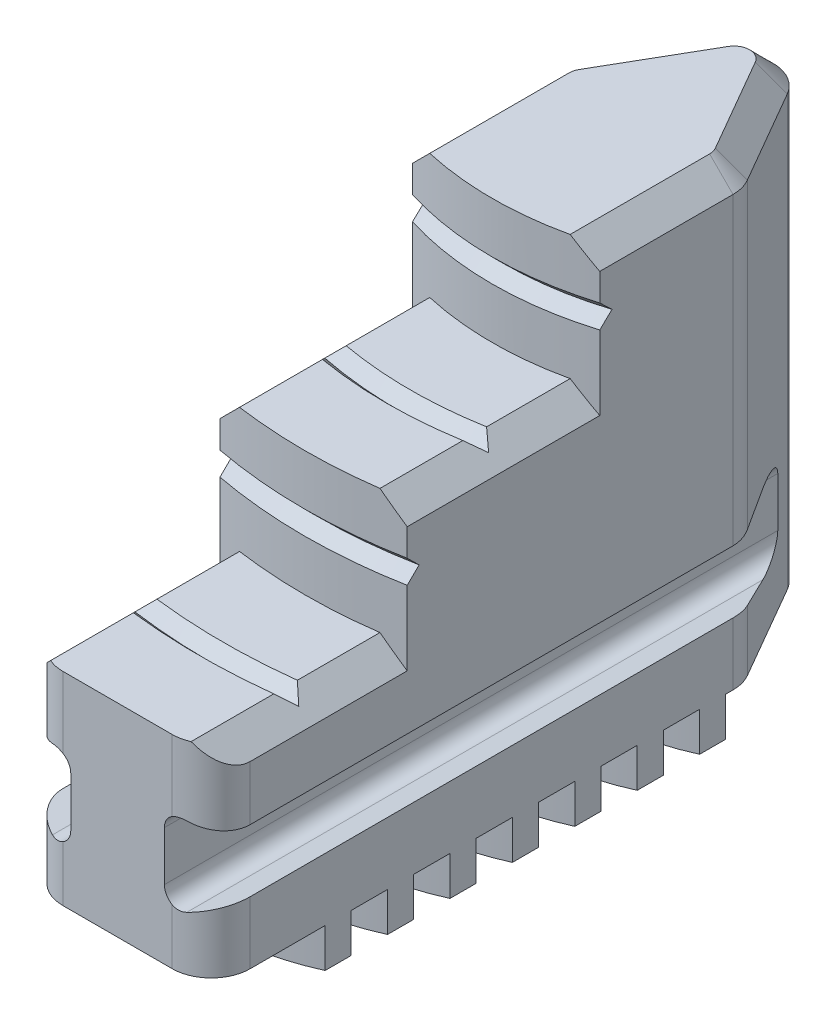
from build123d import *

# Parameters (mm, degrees)
BOSS_EXTRUDE1_DEPTH = 58
BOSS_EXTRUDE2_DEPTH = 5
CUT_EXTRUDE1_DEPTH  = 103.78132126
CHAMFER1_SIZE       = 3


with BuildPart() as part:
    # Sketch1 → Boss-Extrude1 (new body)
    with BuildSketch(Plane(origin=(0, 0, 0), x_dir=(1, 0, 0), z_dir=(0, 1, 0))):
        with BuildLine():
            Line((-7, 0), (7, 0))
            ThreePointArc((7, 0), (10.535533906, 1.464466094), (12, 5))
            Line((12, 5), (12, 66.875644347))
            ThreePointArc((12, 66.875644347), (11.829629131, 68.169739573), (11.330127019, 69.375644347))
            Line((11.330127019, 69.375644347), (4.330127019, 81.5))
            ThreePointArc((4.330127019, 81.5), (0, 84), (-4.330127019, 81.5))
            Line((-4.330127019, 81.5), (-11.330127019, 69.375644347))
            ThreePointArc((-11.330127019, 69.375644347), (-11.829629131, 68.169739573), (-12, 66.875644347))
            Line((-12, 66.875644347), (-12, 5))
            ThreePointArc((-12, 5), (-10.535533906, 1.464466094), (-7, 0))
        make_face()
    extrude(amount=BOSS_EXTRUDE1_DEPTH)

    # Sketch2 → Cut-Revolve3 (revolve, cut)
    with BuildSketch(Plane(origin=(0, 0, 0), x_dir=(0, 0, -1), z_dir=(1, 0, 0))):
        Polygon((48, 61), (48, 58), (48, 51.5), (49.5, 50), (48, 48.5), (48, 42), (37.5, 42), (36, 40.5), (34.5, 42), (24, 42), (24, 35.5), (25.5, 34), (24, 32.5), (24, 26), (13.5, 26), (12, 24.5), (10.5, 26), (0, 26), (-2, 26), (-2, 61), align=None)
    revolve(axis=Axis((0, 58, -89), (0, -1, 0)), mode=Mode.SUBTRACT)

    # Sketch3 → Boss-Extrude2 (add)
    with BuildSketch(Plane.XZ):
        with BuildLine():
            Line((-12, -54.599242435), (-12, -57.934874811))
            ThreePointArc((-12, -57.934874811), (0, -55), (12, -57.934874811))
            Line((12, -57.934874811), (12, -54.599242435))
            ThreePointArc((12, -54.599242435), (0, -52), (-12, -54.599242435))
        make_face()
        with BuildLine():
            Line((-12, -62.599242435), (-12, -65.934874811))
            ThreePointArc((-12, -65.934874811), (0, -63), (12, -65.934874811))
            Line((12, -65.934874811), (12, -62.599242435))
            ThreePointArc((12, -62.599242435), (0, -60), (-12, -62.599242435))
        make_face()
        with BuildLine():
            Line((-12, -46.599242435), (-12, -49.934874811))
            ThreePointArc((-12, -49.934874811), (0, -47), (12, -49.934874811))
            Line((12, -49.934874811), (12, -46.599242435))
            ThreePointArc((12, -46.599242435), (0, -44), (-12, -46.599242435))
        make_face()
        with BuildLine():
            Line((-12, -38.599242435), (-12, -41.934874811))
            ThreePointArc((-12, -41.934874811), (0, -39), (12, -41.934874811))
            Line((12, -41.934874811), (12, -38.599242435))
            ThreePointArc((12, -38.599242435), (0, -36), (-12, -38.599242435))
        make_face()
        with BuildLine():
            Line((-12, -30.599242435), (-12, -33.934874811))
            ThreePointArc((-12, -33.934874811), (0, -31), (12, -33.934874811))
            Line((12, -33.934874811), (12, -30.599242435))
            ThreePointArc((12, -30.599242435), (0, -28), (-12, -30.599242435))
        make_face()
        with BuildLine():
            Line((-12, -22.599242435), (-12, -25.934874811))
            ThreePointArc((-12, -25.934874811), (0, -23), (12, -25.934874811))
            Line((12, -25.934874811), (12, -22.599242435))
            ThreePointArc((12, -22.599242435), (0, -20), (-12, -22.599242435))
        make_face()
        with BuildLine():
            Line((-12, -14.599242435), (-12, -17.934874811))
            ThreePointArc((-12, -17.934874811), (0, -15), (12, -17.934874811))
            Line((12, -17.934874811), (12, -14.599242435))
            ThreePointArc((12, -14.599242435), (0, -12), (-12, -14.599242435))
        make_face()
    extrude(amount=BOSS_EXTRUDE2_DEPTH)

    # Sketch4 → Cut-Extrude1 (cut, through all)
    with BuildSketch(Plane.XY):
        with BuildLine():
            Line((12, 16), (8.601411599, 17.071570807))
            ThreePointArc((8.601411599, 17.071570807), (6.817380703, 16.777026114), (6, 15.164136905))
            Line((6, 15.164136905), (6, 8.835863095))
            ThreePointArc((6, 8.835863095), (6.817380703, 7.222973886), (8.601411599, 6.928429193))
            Line((8.601411599, 6.928429193), (12, 8))
            Line((12, 8), (12, 16))
        make_face()
        with BuildLine():
            Line((-12, 8), (-12, 16))
            Line((-12, 16), (-8.601411599, 17.071570807))
            ThreePointArc((-8.601411599, 17.071570807), (-6.817380703, 16.777026114), (-6, 15.164136905))
            Line((-6, 15.164136905), (-6, 8.835863095))
            ThreePointArc((-6, 8.835863095), (-6.817380703, 7.222973886), (-8.601411599, 6.928429193))
            Line((-8.601411599, 6.928429193), (-12, 8))
        make_face()
    extrude(amount=-CUT_EXTRUDE1_DEPTH, mode=Mode.SUBTRACT)

    # Chamfer1
    # the kernel refuses this chamfer: 3.639332034, 3.399408886, 3, 2.719454555, 2.619340105 mm, written as the material it takes off along each edge
    with BuildSketch(Plane(origin=(7, 58, -66.875644347), x_dir=(1, 0, 0), z_dir=(0, 0, 1))) as chamfer1_piece_1:
        Polygon((5 - CHAMFER1_SIZE, 0), (5, -CHAMFER1_SIZE), (5, 0), align=None)
    revolve(axis=Axis((7, 58, -66.875644347), (0, 1, 0)), revolution_arc=30, mode=Mode.SUBTRACT)
    with BuildSketch(Plane(origin=(11.330127019, 58, -69.375644347), x_dir=(0, -1, 0), z_dir=(-0.5000000000000017, 0, -0.8660254037844377)), Plane(origin=(-4.330127019, 58, -81.5), x_dir=(0, -1, 0), z_dir=(-0.5000000000000012, 0, 0.8660254037844379))) as chamfer1_piece_2:
        Polygon((CHAMFER1_SIZE, 0), (0, CHAMFER1_SIZE), (0, 0), align=None)
    extrude(amount=14, mode=Mode.SUBTRACT)
    with BuildSketch(Plane(origin=(0, 58, -79), x_dir=(0.8660254037844403, 0, -0.49999999999999706), z_dir=(0.49999999999999706, 0, 0.8660254037844403))) as chamfer1_piece_3:
        Polygon((5, -CHAMFER1_SIZE), (5 - CHAMFER1_SIZE, 0), (5, 0), align=None)
    revolve(axis=Axis((0, 58, -79), (0, 1, 0)), revolution_arc=120, mode=Mode.SUBTRACT)
    with BuildSketch(Plane(origin=(-7, 58, -66.875644347), x_dir=(-0.866025403784439, 0, -0.4999999999999992), z_dir=(0.4999999999999992, 0, -0.866025403784439))) as chamfer1_piece_4:
        Polygon((5, -CHAMFER1_SIZE), (5 - CHAMFER1_SIZE, 0), (5, 0), align=None)
    revolve(axis=Axis((-7, 58, -66.875644347), (0, 1, 0)), revolution_arc=30, mode=Mode.SUBTRACT)
    with BuildSketch(Plane(origin=(12, 58, -42.080359468), x_dir=(-1, 0, 0), z_dir=(0, 0, -1)), Plane(origin=(-12, 58, -66.875644347), x_dir=(1, 0, 0), z_dir=(0, 0, 1))) as chamfer1_piece_5:
        Polygon((CHAMFER1_SIZE, 0), (0, -CHAMFER1_SIZE), (0, 0), align=None)
    extrude(amount=24.795284879, mode=Mode.SUBTRACT)
    with BuildSketch(Plane(origin=(-12, 42, -43.55256219), x_dir=(0, -1, 0), z_dir=(0, 0, 1)), Plane(origin=(12, 42, -17.402246021), x_dir=(0, -1, 0), z_dir=(0, 0, -1))) as chamfer1_piece_6:
        Polygon((CHAMFER1_SIZE, 0), (0, CHAMFER1_SIZE), (0, 0), align=None)
    extrude(amount=26.150316168, mode=Mode.SUBTRACT)
    with BuildSketch(Plane(origin=(12, 26, 2.715048964), x_dir=(-1, 0, 0), z_dir=(0, 0, -1)), Plane(origin=(-12, 26, -19.13766824), x_dir=(1, 0, 0), z_dir=(0, 0, 1))) as chamfer1_piece_7:
        Polygon((CHAMFER1_SIZE, 0), (0, -CHAMFER1_SIZE), (0, 0), align=None)
    extrude(amount=21.852717204, mode=Mode.SUBTRACT)
    # the kernel refuses this chamfer: 3.639332034, 3.399408886, 3, 2.719454555, 2.619340105 mm, written as the material it takes off along each edge
    with BuildSketch(Plane(origin=(-12, 42, -57.510457396), x_dir=(0, -1, 0), z_dir=(0, 0, 1))) as chamfer1_2_piece_1_section:
        Polygon((CHAMFER1_SIZE, 0), (0, CHAMFER1_SIZE), (0, 0), align=None)
    chamfer1_2_piece_1 = extrude(amount=21.67294417, mode=Mode.PRIVATE)
    chamfer1_2_piece_1 = chamfer1_2_piece_1 - Plane(origin=(0, 42, -89), x_dir=(0, 0, 1), z_dir=(0, -1, 0)) * Cylinder(41, 56, mode=Mode.PRIVATE)
    add(chamfer1_2_piece_1, mode=Mode.SUBTRACT)
    with BuildSketch(Plane(origin=(-12, 26, -32.832343949), x_dir=(0, -1, 0), z_dir=(0, 0, 1))) as chamfer1_2_piece_2_section:
        Polygon((CHAMFER1_SIZE, 0), (0, CHAMFER1_SIZE), (0, 0), align=None)
    chamfer1_2_piece_2 = extrude(amount=21.409724673, mode=Mode.PRIVATE)
    chamfer1_2_piece_2 = chamfer1_2_piece_2 - Plane(origin=(0, 26, -89), x_dir=(0, 0, 1), z_dir=(0, -1, 0)) * Cylinder(65, 55, mode=Mode.PRIVATE)
    add(chamfer1_2_piece_2, mode=Mode.SUBTRACT)
    with BuildSketch(Plane(origin=(12, 26, -11.422619276), x_dir=(0, -1, 0), z_dir=(0, 0, -1))) as chamfer1_2_piece_3_section:
        Polygon((CHAMFER1_SIZE, 0), (0, CHAMFER1_SIZE), (0, 0), align=None)
    chamfer1_2_piece_3 = extrude(amount=21.409724673, mode=Mode.PRIVATE)
    chamfer1_2_piece_3 = chamfer1_2_piece_3 - Plane(origin=(0, 26, -89), x_dir=(0, 0, 1), z_dir=(0, -1, 0)) * Cylinder(65, 55, mode=Mode.PRIVATE)
    add(chamfer1_2_piece_3, mode=Mode.SUBTRACT)
    with BuildSketch(Plane(origin=(12, 42, -35.837513226), x_dir=(0, -1, 0), z_dir=(0, 0, -1))) as chamfer1_2_piece_4_section:
        Polygon((CHAMFER1_SIZE, 0), (0, CHAMFER1_SIZE), (0, 0), align=None)
    chamfer1_2_piece_4 = extrude(amount=21.67294417, mode=Mode.PRIVATE)
    chamfer1_2_piece_4 = chamfer1_2_piece_4 - Plane(origin=(0, 42, -89), x_dir=(0, 0, 1), z_dir=(0, -1, 0)) * Cylinder(41, 56, mode=Mode.PRIVATE)
    add(chamfer1_2_piece_4, mode=Mode.SUBTRACT)


solid = part.part
